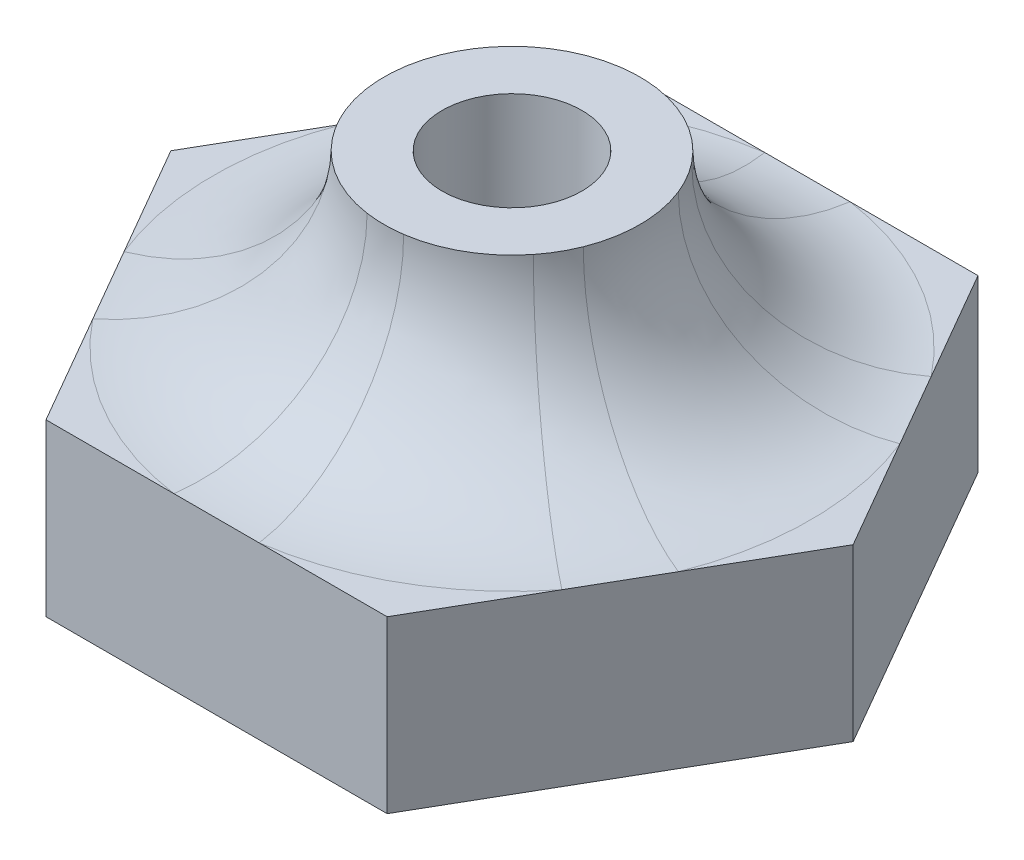
from build123d import *

# Parameters (mm, degrees)
BOSS_EXTRUDE1_DEPTH = 10
SKETCH2_R           = 4.1
CUT_EXTRUDE1_DEPTH  = 29.284271247
CUT_EXTRUDE2_DEPTH  = 8
BOSS_EXTRUDE2_START = 10
SKETCH4_R           = 7.5
SKETCH4_R_2         = 4.1
BOSS_EXTRUDE2_DEPTH = 10
FILLET1_R           = 10


with BuildPart() as part:
    # Sketch1 → Boss-Extrude1 (new body)
    with BuildSketch(Plane(origin=(0, 0, 0), x_dir=(1, 0, 0), z_dir=(0, 1, 0))):
        Polygon((-10, 17.320508076), (-20, 0), (-10, -17.320508076), (10, -17.320508076), (20, 0), (10, 17.320508076), align=None)
    extrude(amount=BOSS_EXTRUDE1_DEPTH)

    # Sketch2 → Cut-Extrude1 (cut, through all)
    with BuildSketch(Plane(origin=(0, 10, 0), x_dir=(1, 0, 0), z_dir=(0, 1, 0))):
        with Locations(Location((0, 0, 0), (0, 0, 270))):
            Circle(SKETCH2_R)
    extrude(amount=-CUT_EXTRUDE1_DEPTH, mode=Mode.SUBTRACT)

    # Sketch3 → Cut-Extrude2 (cut)
    with BuildSketch(Plane.XZ):
        Polygon((7.5, 0), (3.75, 6.495190528), (-3.75, 6.495190528), (-7.5, 0), (-3.75, -6.495190528), (3.75, -6.495190528), align=None)
    extrude(amount=-CUT_EXTRUDE2_DEPTH, mode=Mode.SUBTRACT)

    # Sketch4 → Boss-Extrude2 (add)
    with BuildSketch(Plane(origin=(0, 10, 0), x_dir=(1, 0, 0), z_dir=(0, 1, 0)).offset(BOSS_EXTRUDE2_START)):
        with Locations(Location((0, 0, 0), (0, 0, 270))):
            Circle(SKETCH4_R)
        with Locations(Location((0, 0, 0), (0, 0, 270))):
            Circle(SKETCH4_R_2, mode=Mode.SUBTRACT)
    extrude(amount=-BOSS_EXTRUDE2_DEPTH)

    # Fillet1
    fillet1_edges = [part.edges().sort_by_distance(p)[0] for p in [
        (0, 10, -7.5),
    ]]
    fillet(fillet1_edges, radius=FILLET1_R - 0.0001)  # a hair under: the kernel refuses the full size


solid = part.part
